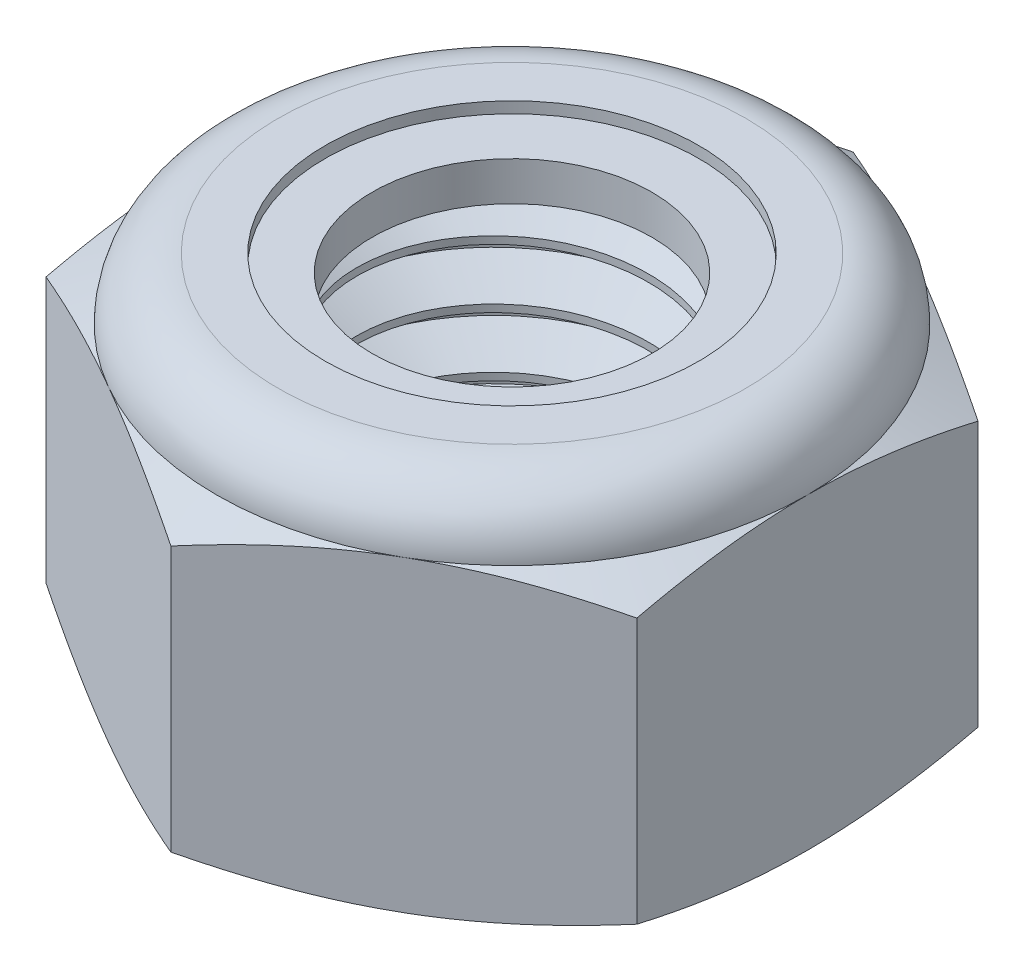
from build123d import *

# Parameters (mm, degrees)
EXTRUDE1_DEPTH   = 5
SKETCH2_W        = 2.5
SKETCH2_H        = 5
CUT_SWEEP1_PITCH = 0.8


with BuildPart() as part:
    # Sketch1 → Extrude1 (new body)
    with BuildSketch(Plane(origin=(0, 0, 0), x_dir=(1, 0, 0), z_dir=(0, 1, 0))):
        Polygon((0, 4.618802154), (-4, 2.309401077), (-4, -2.309401077), (0, -4.618802154), (4, -2.309401077), (4, 2.309401077), align=None)
    extrude(amount=EXTRUDE1_DEPTH)


with BuildPart() as body_2:
    # Sketch2 → Revolve1 (revolve)
    with BuildSketch(Plane(origin=(0, 0, 0), x_dir=(0, 0, -1), z_dir=(1, 0, 0))):
        with Locations((1.25, 2.5)):
            Rectangle(SKETCH2_W, SKETCH2_H)
    revolve(axis=Axis((0, -2.5, 0), (0, 1, 0)))

    # Boss-Extrude1 cone 1 section (through the dimple's axis) → Boss-Extrude1 (revolve)
    with BuildSketch(Plane(origin=(0, 0, 0), x_dir=(0, 0, -1), z_dir=(1, 0, 0))):
        Polygon((0, 0), (2.5, 0), (0, 2.5), align=None)
    revolve(axis=Axis((0, 0, 0), (0, 1, 0)))

    # Boss-Extrude2 cone 1 section (through the dimple's axis) → Boss-Extrude2 (revolve)
    with BuildSketch(Plane(origin=(0, 5, 0), x_dir=(0, 0, 1), z_dir=(1, 0, 0))):
        Polygon((0, 0), (2.5, 0), (0, 2.5), align=None)
    revolve(axis=Axis((0, 5, 0), (0, -1, 0)))

    # Cut-Sweep1: the profile of Sketch9 profile screwed along a right-hand helix of 7.25 turns, 8 arcs to a turn; built about Z, then put on its axis
    cut_sweep1_z = Axis((0, 0, 0), (0, 0, 1))
    cut_sweep1_corners = [(2.5003, 0, -0.700173205), (2.5003, 0, 0.000173205), (1.980384758, 0, -0.3), (1.980384758, 0, -0.4)]
    with BuildLine(mode=Mode.PRIVATE) as cut_sweep1_profile:
        Line(cut_sweep1_corners[0], cut_sweep1_corners[1])
        Line(cut_sweep1_corners[1], cut_sweep1_corners[2])
        Line(cut_sweep1_corners[2], cut_sweep1_corners[3])
        Line(cut_sweep1_corners[3], cut_sweep1_corners[0])
    cut_sweep1_cap = Face(cut_sweep1_profile.wire())
    cut_sweep1_turn_angles = [0, 22.5, 45, 67.5, 90, 112.5, 135, 157.5, 180, 202.5, 225, 247.5, 270, 292.5, 315, 337.5, 360]
    cut_sweep1_turn_weights = [1, 0.9238795325112867, 1, 0.9238795325112867, 1, 0.9238795325112867, 1, 0.9238795325112867, 1, 0.9238795325112867, 1, 0.9238795325112867, 1, 0.9238795325112867, 1, 0.9238795325112867, 1]
    cut_sweep1_turn_rails = [Edge.make_bspline([Vector(p[0], p[1], 0).rotate(cut_sweep1_z, cut_sweep1_turn_angles[k]) / cut_sweep1_turn_weights[k] + Vector(0, 0, p[2] + CUT_SWEEP1_PITCH * cut_sweep1_turn_angles[k] / 360) for k in range(17)], [0, 0, 0, 1, 1, 2, 2, 3, 3, 4, 4, 5, 5, 6, 6, 7, 7, 8, 8, 8], 2, cut_sweep1_turn_weights) for p in cut_sweep1_corners]
    cut_sweep1_turn_sides = [Face.make_surface_from_curves(cut_sweep1_turn_rails[p[0]], cut_sweep1_turn_rails[p[1]]) for p in [(0, 1), (1, 2), (2, 3), (3, 0)]]
    cut_sweep1_last_angles = [2520, 2542.5, 2565, 2587.5, 2610]
    cut_sweep1_last_weights = [1, 0.9238795325112867, 1, 0.923879532511299, 1]
    cut_sweep1_last_rails = [Edge.make_bspline([Vector(p[0], p[1], 0).rotate(cut_sweep1_z, cut_sweep1_last_angles[k]) / cut_sweep1_last_weights[k] + Vector(0, 0, p[2] + CUT_SWEEP1_PITCH * cut_sweep1_last_angles[k] / 360) for k in range(5)], [0, 0, 0, 1, 1, 2, 2, 2], 2, cut_sweep1_last_weights) for p in cut_sweep1_corners]
    cut_sweep1_last_sides = [Face.make_surface_from_curves(cut_sweep1_last_rails[p[0]], cut_sweep1_last_rails[p[1]]) for p in [(0, 1), (1, 2), (2, 3), (3, 0)]]
    cut_sweep1 = Plane(origin=(0, 0, 0), x_dir=(0, 0, -1), z_dir=(0, 1, 0)) * Solid(Shell([*[p.moved(Location((0, 0, CUT_SWEEP1_PITCH * i))) for i in range(7) for p in cut_sweep1_turn_sides], *cut_sweep1_last_sides, cut_sweep1_cap, cut_sweep1_cap.rotate(cut_sweep1_z, 2610).moved(Location((0, 0, CUT_SWEEP1_PITCH * 2610 / 360)))]))
    add(cut_sweep1, mode=Mode.SUBTRACT)


with BuildPart() as part_1:
    add(part.part)

    # Combine1: cut body 2
    add(body_2.part, mode=Mode.SUBTRACT)

    # Sketch5 → Cut-Revolve3 (revolve, cut)
    with BuildSketch(Plane(origin=(0, 0, 0), x_dir=(0, 0, -1), z_dir=(1, 0, 0))):
        with BuildLine():
            Line((0, 0), (4, 0))
            Line((4, 0), (4.618802154, 0.288552183))
            Line((4.618802154, 0.288552183), (4.618802154, 3.878114484))
            Line((4.618802154, 3.878114484), (4, 4.166666667))
            ThreePointArc((4, 4.166666667), (3.755922318, 4.755922318), (3.166666667, 5))
            Line((3.166666667, 5), (3.166666667, 6.27))
            Line((3.166666667, 6.27), (5.888802154, 6.27))
            Line((5.888802154, 6.27), (5.888802154, -1.27))
            Line((5.888802154, -1.27), (0, -1.27))
            Line((0, -1.27), (0, 0))
        make_face()
    revolve(axis=Axis((0, 0, 0), (0, 1, 0)), mode=Mode.SUBTRACT)

    # Sketch6 → Cut-Revolve4 (revolve, cut)
    with BuildSketch(Plane(origin=(0, 0, 0), x_dir=(0, 0, -1), z_dir=(1, 0, 0)), mode=Mode.PRIVATE) as cut_revolve4_sk:
        with BuildLine():
            Line((0, 4.166666667), (3.8476, 4.166666667))
            ThreePointArc((3.8476, 4.166666667), (3.648159244, 4.648159244), (3.166666667, 4.8476))
            Line((3.166666667, 4.8476), (2.530224442, 4.8476))
            Line((2.530224442, 4.8476), (2.530224442, 6.27))
            Line((2.530224442, 6.27), (0, 6.27))
            Line((0, 6.27), (0, 4.166666667))
        make_face()
    revolve(cut_revolve4_sk.sketch.rotate(Axis((0, 6.27, 0), (0, -1, 0)), 180), axis=Axis((0, 6.27, 0), (0, -1, 0)), mode=Mode.SUBTRACT)


with BuildPart() as body_2_2:
    # Sketch7 → Revolve2 (revolve)
    with BuildSketch(Plane(origin=(0, 0, 0), x_dir=(0, 0, -1), z_dir=(1, 0, 0))):
        with BuildLine():
            Line((1.893782217, 4.242866667), (3.766579964, 4.242866667))
            ThreePointArc((3.766579964, 4.242866667), (3.566430175, 4.620419399), (3.166666667, 4.7714))
            Line((3.166666667, 4.7714), (1.893782217, 4.7714))
            Line((1.893782217, 4.7714), (1.893782217, 4.242866667))
        make_face()
    revolve(axis=Axis((0, 4.242866667, 0), (0, 1, 0)))


solid = Compound([part_1.part, body_2_2.part])
